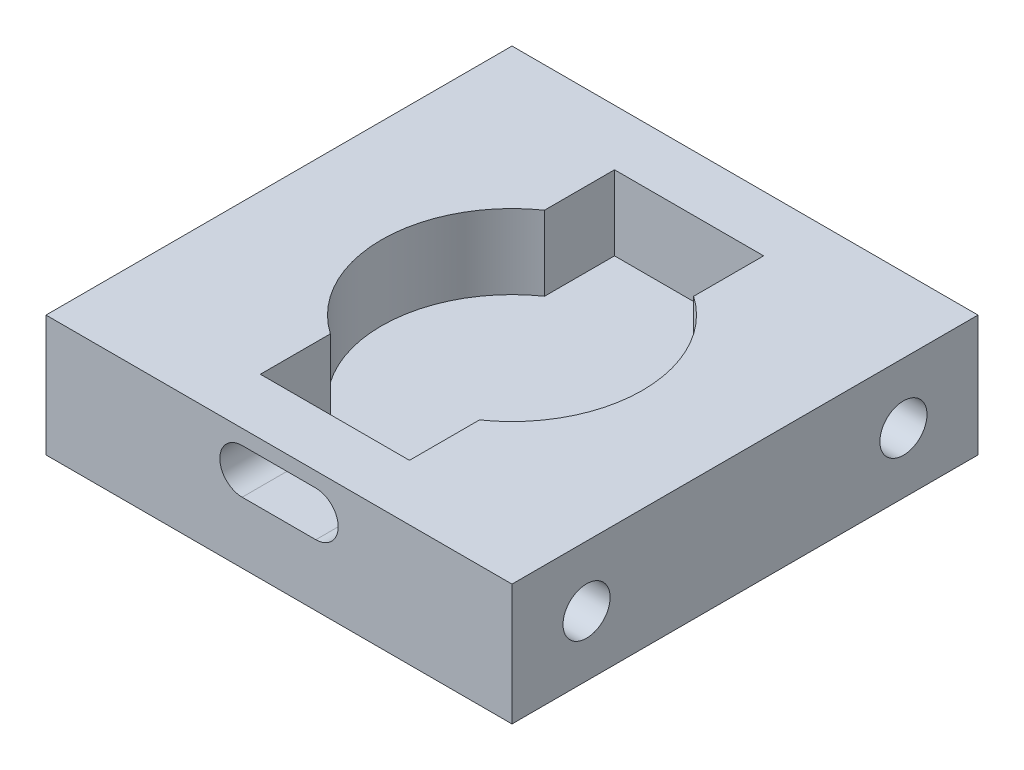
from build123d import *

# Parameters (mm, degrees)
SKETCH1_W                       = 50
SKETCH1_H                       = 50
BOSS_EXTRUDE1_DEPTH             = 13
BOSS_EXTRUDE2_DEPTH             = 5
F_8_0_199_DIAMETER_HOLE1_D      = 5.0546
F_8_0_199_DIAMETER_HOLE1_DEPTH  = 17
F_12_START                      = 19
F_12_0_189_DIAMETER_SLOT1_DEPTH = 6


# Read off the part's stored shape, not the designer's step: #12 (0.189) Diameter Slot1
with BuildPart() as part:
    # Sketch1 → Boss-Extrude1 (new body)
    with BuildSketch(Plane(origin=(0, 0, 0), x_dir=(1, 0, 0), z_dir=(0, 1, 0))):
        Rectangle(SKETCH1_W, SKETCH1_H)
        with BuildLine():
            Line((-8, 19), (8, 19))
            Line((8, 19), (8, 11.489125293))
            ThreePointArc((8, 11.489125293), (12.409673646, 6.480740698), (14, 0))
            ThreePointArc((14, 0), (12.409673646, -6.480740698), (8, -11.489125293))
            Line((8, -11.489125293), (8, -19))
            Line((8, -19), (-8, -19))
            Line((-8, -19), (-8, -11.489125293))
            ThreePointArc((-8, -11.489125293), (-14, 0), (-8, 11.489125293))
            Line((-8, 11.489125293), (-8, 19))
        make_face(mode=Mode.SUBTRACT)
    extrude(amount=BOSS_EXTRUDE1_DEPTH)

    # Sketch1<3> → Boss-Extrude2 (add)
    with BuildSketch(Plane(origin=(0, 0, 0), x_dir=(1, 0, 0), z_dir=(0, 1, 0))):
        with BuildLine():
            Line((8, -19), (8, -11.489125293))
            ThreePointArc((8, -11.489125293), (0, -14), (-8, -11.489125293))
            Line((-8, -11.489125293), (-8, -19))
            Line((-8, -19), (8, -19))
        make_face()
        with BuildLine():
            Line((8, -11.489125293), (8, 11.489125293))
            ThreePointArc((8, 11.489125293), (0, 14), (-8, 11.489125293))
            Line((-8, 11.489125293), (-8, -11.489125293))
            ThreePointArc((-8, -11.489125293), (0, -14), (8, -11.489125293))
        make_face()
        with BuildLine():
            Line((-8, -11.489125293), (-8, 11.489125293))
            ThreePointArc((-8, 11.489125293), (-14, 0), (-8, -11.489125293))
        make_face()
        with BuildLine():
            Line((8, 11.489125293), (8, 19))
            Line((8, 19), (-8, 19))
            Line((-8, 19), (-8, 11.489125293))
            ThreePointArc((-8, 11.489125293), (0, 14), (8, 11.489125293))
        make_face()
        with BuildLine():
            ThreePointArc((14, 0), (12.409673646, 6.480740698), (8, 11.489125293))
            Line((8, 11.489125293), (8, -11.489125293))
            ThreePointArc((8, -11.489125293), (12.409673646, -6.480740698), (14, 0))
        make_face()
    extrude(amount=BOSS_EXTRUDE2_DEPTH)

    # #8 (0.199) Diameter Hole1
    with Locations(Plane(origin=(25, 0, 0), x_dir=(0, 0, -1), z_dir=(1, 0, 0))):
        with Locations((-17, 6.5), (17, 6.5)):
            Hole(F_8_0_199_DIAMETER_HOLE1_D / 2, depth=F_8_0_199_DIAMETER_HOLE1_DEPTH)

    # #12 (0.189) Diameter Slot1 outline → #12 (0.189) Diameter Slot1 (cut)
    with BuildSketch(Plane.XY.offset(F_12_START)):
        with BuildLine():
            Line((-3.9497, 6.5997), (3.9497, 6.5997))
            ThreePointArc((3.9497, 6.5997), (6.35, 9), (3.9497, 11.4003))
            Line((3.9497, 11.4003), (-3.9497, 11.4003))
            ThreePointArc((-3.9497, 11.4003), (-6.35, 9), (-3.9497, 6.5997))
        make_face()
    extrude(amount=F_12_0_189_DIAMETER_SLOT1_DEPTH, mode=Mode.SUBTRACT)


solid = part.part
